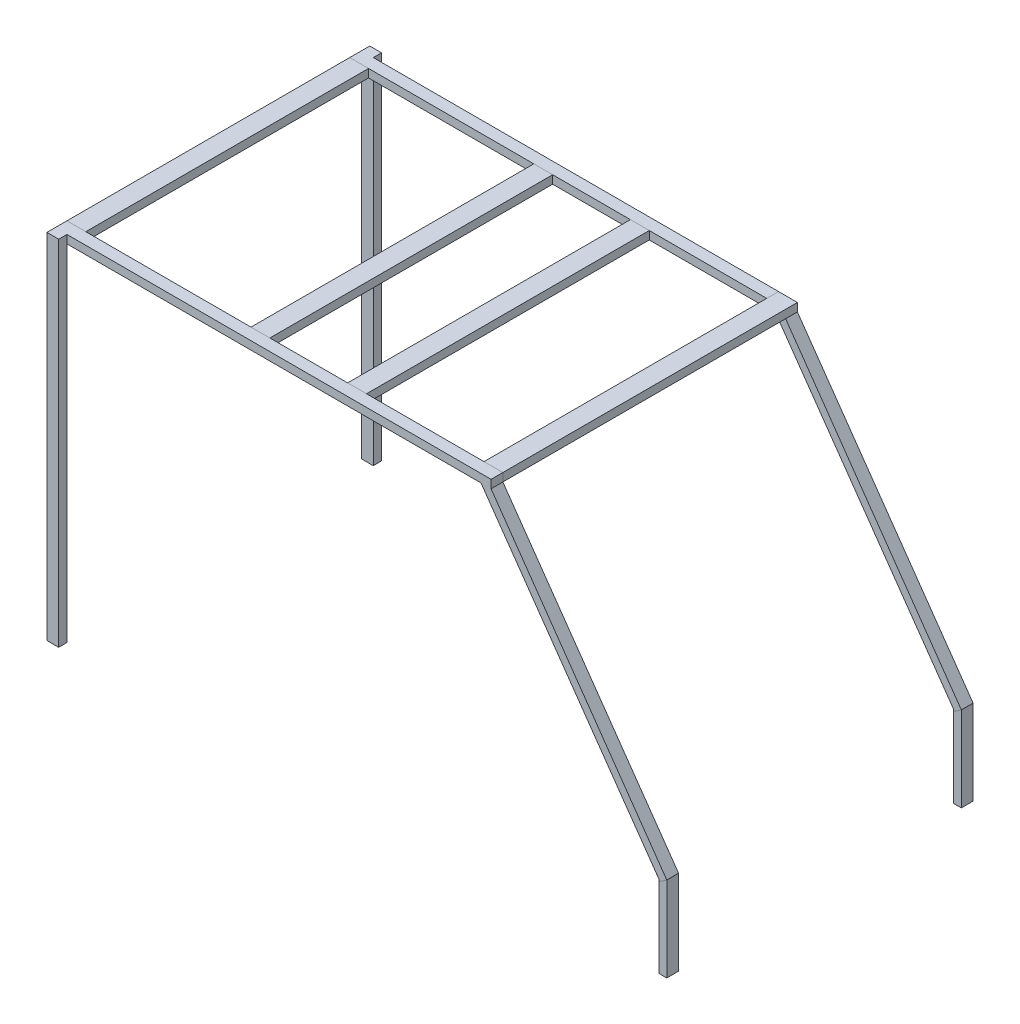
from build123d import *

# Parameters (mm, degrees)
SKETCH2_W                       = 5
SKETCH2_H                       = 3.5
BOSS_EXTRUDE1_DEPTH             = 150
SKETCH5_W                       = 5
SKETCH5_H                       = 3.5
BOSS_EXTRUDE2_DEPTH             = 5
SKETCH7_W                       = 5
SKETCH7_H                       = 3.481165415
BOSS_EXTRUDE3_DEPTH             = 180
SKETCH11_W                      = 5
SKETCH11_H                      = 3.5
BOSS_EXTRUDE4_DEPTH             = 130
BOSS_EXTRUDE4_DIRECTION_2_REACH = 237.646
BOSS_EXTRUDE14_DEPTH            = 6
BOSS_EXTRUDE14_DEPTH_BACK       = 30
SKETCH23_W                      = 3.317254227
SKETCH23_H                      = 5
MIRROR7_START                   = 126.75
MIRROR7_DEPTH                   = 5
MIRROR7_START_2                 = 131.75
MIRROR7_2_OUTLINE_W             = 5
MIRROR7_2_OUTLINE_H             = 150
MIRROR7_2_DEPTH                 = 3.5
SKETCH26_W                      = 8
SKETCH26_H                      = 3.481165415
BOSS_EXTRUDE16_DEPTH            = 125
SKETCH30_W                      = 8
SKETCH30_H                      = 3.481165415
BOSS_EXTRUDE22_DEPTH            = 120
SKETCH31_W                      = 8
SKETCH31_H                      = 3.481165415
BOSS_EXTRUDE23_DEPTH            = 120
SKETCH29_W                      = 8
SKETCH29_H                      = 3.5
BOSS_EXTRUDE26_DEPTH            = 125


# Read off the part's stored shape, not the designer's step: Mirror7
with BuildPart() as part:
    # Sketch2 → Boss-Extrude1 (new body)
    with BuildSketch(Plane(origin=(0, 0, 0), x_dir=(1, 0, 0), z_dir=(0, 1, 0))):
        Rectangle(SKETCH2_W, SKETCH2_H)
    extrude(amount=BOSS_EXTRUDE1_DEPTH)

    # Sketch5 → Boss-Extrude2 (add)
    with BuildSketch(Plane.XY.offset(1.75)):
        with Locations((0, 148.25)):
            Rectangle(SKETCH5_W, SKETCH5_H)
    extrude(amount=BOSS_EXTRUDE2_DEPTH)

    # Sketch7 → Boss-Extrude3 (add)
    with BuildSketch(Plane(origin=(2.5, 0, 0), x_dir=(0, 0, -1), z_dir=(1, 0, 0))):
        with Locations((-4.25, 148.259417293)):
            Rectangle(SKETCH7_W, SKETCH7_H)
    extrude(amount=BOSS_EXTRUDE3_DEPTH)

    # Sketch11 → Boss-Extrude4 (add)
    with BuildSketch(Plane(origin=(-8.800671911, 12.568662048, 0), x_dir=(0, 0, -1), z_dir=(0.5735764363510444, -0.819152044288993, 0))):
        with Locations((-4.25, 231.784999082)):
            Rectangle(SKETCH11_W, SKETCH11_H)
    extrude(amount=BOSS_EXTRUDE4_DEPTH)

    # Boss-Extrude4 direction 2: up to this face of the body (flat: up to its plane)
    boss_extrude4_direction_2_end = Plane(part.part.faces().sort_by_distance((88.328912467, 150, 4.171087533))[0])
    # Sketch11 → Boss-Extrude4 direction 2 (add, up to the picked face)
    with BuildSketch(Plane(origin=(-8.800671911, 12.568662048, 0), x_dir=(0, 0, -1), z_dir=(0.5735764363510444, -0.819152044288993, 0)), mode=Mode.PRIVATE) as boss_extrude4_direction_2_sk1:
        with Locations((-4.25, 231.784999082)):
            Rectangle(SKETCH11_W, SKETCH11_H)
    boss_extrude4_direction_2_tool1 = split(extrude(boss_extrude4_direction_2_sk1.sketch, amount=-BOSS_EXTRUDE4_DIRECTION_2_REACH, mode=Mode.PRIVATE), bisect_by=boss_extrude4_direction_2_end, keep=Keep.BOTH, mode=Mode.PRIVATE)
    add(boss_extrude4_direction_2_tool1.solids().sort_by(Axis((181.066484, 145.515076, 4.25), (-0.5735764363510444, 0.819152044288993, 0)))[0])


with BuildPart() as body_2:
    # Sketch23 → Boss-Extrude14 (new, two sides: drawn at the far end of the back side and taken through both)
    with BuildSketch(Plane(origin=(0, 34, 0), x_dir=(1, 0, 0), z_dir=(0, 1, 0)).offset(-BOSS_EXTRUDE14_DEPTH_BACK)):
        with Locations((255.406309613, -4.25)):
            Rectangle(SKETCH23_W, SKETCH23_H)
    extrude(amount=BOSS_EXTRUDE14_DEPTH + BOSS_EXTRUDE14_DEPTH_BACK)


with BuildPart() as body_3:
    # Mirror7 outline → Mirror7 (new body)
    with BuildSketch(Plane.XY.offset(MIRROR7_START)):
        Polygon((182.5, 150), (-2.5, 150), (-2.5, 146.5), (2.5, 146.5), (2.5, 146.518834585), (178.227288939, 146.518834585), (254.197904571, 38.0215513), (257.064936726, 40.029068827), (182.5, 146.518834585), align=None)
    extrude(amount=MIRROR7_DEPTH)

    # Mirror7 2 outline → Mirror7 2 (add)
    with BuildSketch(Plane.XY.offset(MIRROR7_START_2)):
        with Locations((0, 75)):
            Rectangle(MIRROR7_2_OUTLINE_W, MIRROR7_2_OUTLINE_H)
    extrude(amount=MIRROR7_2_DEPTH)


with BuildPart() as body_4:
    # Sketch26 → Boss-Extrude16 (new body)
    with BuildSketch(Plane(origin=(0, 0, 126.75), x_dir=(-1, 0, 0), z_dir=(0, 0, -1))):
        with Locations((-178.5, 148.259417293)):
            Rectangle(SKETCH26_W, SKETCH26_H)
    extrude(amount=BOSS_EXTRUDE16_DEPTH)


with BuildPart() as body_5:
    # Sketch30 → Boss-Extrude22 (new body)
    with BuildSketch(Plane(origin=(0, 0, 126.75), x_dir=(-1, 0, 0), z_dir=(0, 0, -1))):
        with Locations((-120.62899812, 148.259417293)):
            Rectangle(SKETCH30_W, SKETCH30_H)
    extrude(amount=BOSS_EXTRUDE22_DEPTH)


with BuildPart() as body_6:
    # Sketch31 → Boss-Extrude23 (new body)
    with BuildSketch(Plane(origin=(0, 0, 126.75), x_dir=(-1, 0, 0), z_dir=(0, 0, -1))):
        with Locations((-79.625299037, 148.259417293)):
            Rectangle(SKETCH31_W, SKETCH31_H)
    extrude(amount=BOSS_EXTRUDE23_DEPTH)


with BuildPart() as body_7:
    # Sketch29 → Boss-Extrude26 (new body)
    with BuildSketch(Plane(origin=(0, 0, 126.75), x_dir=(-1, 0, 0), z_dir=(0, 0, -1))):
        with Locations((-1.5, 148.25)):
            Rectangle(SKETCH29_W, SKETCH29_H)
    extrude(amount=BOSS_EXTRUDE26_DEPTH)


with BuildPart() as body_8:
    # Mirror8: mirrored copy
    add(body_2.part.mirror(Plane.XY.offset(66.75)))


solid = Compound([part.part, body_2.part, body_3.part, body_4.part, body_5.part, body_6.part, body_7.part, body_8.part])
